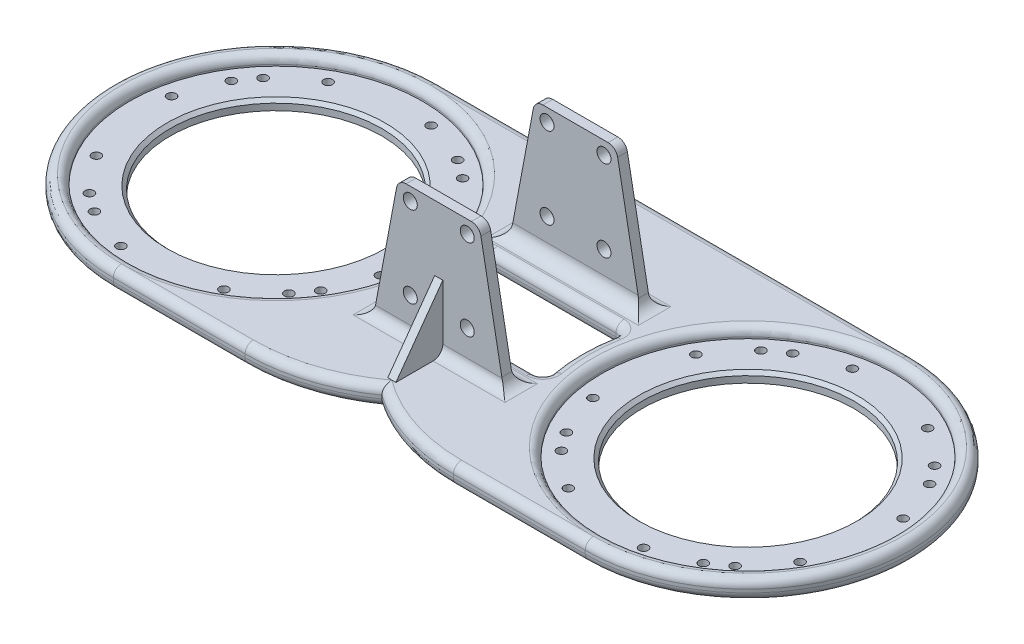
from build123d import *

# Parameters (mm, degrees)
EXTRUDE_1_DEPTH      = 6
EXTRUDE_1_DEPTH_BACK = 6
CUT_EXTRUDE_1_REACH  = 266.69
SKETCH_3_R           = 2.75
CUT_EXTRUDE_2_REACH  = 266.894
FILLET_1_R           = 5
FILLET_2_R           = 5
CHAMFER_1_SIZE       = 2
EXTRUDE_2_DEPTH      = 45
SKETCH_6_W           = 78
SKETCH_6_H           = 80
CUT_EXTRUDE_3_DEPTH  = 75
RIB_2_REACH          = 280.246
SKETCH_7_WALL_W      = 605.662493284
SKETCH_7_WALL_H      = 5
RIB_3_REACH          = 280.246
SKETCH_8_WALL_W      = 607.810143504
SKETCH_8_WALL_H      = 5
CUT_EXTRUDE_4_REACH  = 299.399
SKETCH_9_R           = 4.3
FILLET_4_R           = 8
FILLET_5_R           = 6
FILLET_6_R           = 6
CUT_EXTRUDE_5_REACH  = 278.451
FILLET_7_R           = 5


with BuildPart() as part:
    # 草图1 → 凸台-拉伸1 (new, two sides: drawn at the far end of the back side and taken through both)
    with BuildSketch(Plane(origin=(0, 0, 0), x_dir=(1, 0, 0), z_dir=(0, 1, 0)).offset(-EXTRUDE_1_DEPTH_BACK)):
        with BuildLine():
            Line((-145, 100), (145, 100))
            ThreePointArc((145, 100), (245, 0), (145, -100))
            Line((145, -100), (-145, -100))
            ThreePointArc((-145, -100), (-245, 0), (-145, 100))
        make_face()
    extrude(amount=EXTRUDE_1_DEPTH + EXTRUDE_1_DEPTH_BACK)

    # 草图2 → 切除-旋转1 (revolve, cut)
    with BuildSketch(Plane.XY, mode=Mode.PRIVATE) as cut_revolve_1_sk:
        Polygon((-145, -6), (-80, -6), (-80, 0), (-55, 0), (-55, 6), (-145, 6), align=None)
    cut_revolve_1 = revolve(cut_revolve_1_sk.sketch.rotate(Axis((-145, 6, 0), (0, -1, 0)), 90), axis=Axis((-145, 6, 0), (0, -1, 0)), mode=Mode.SUBTRACT)

    # 草图3 → 切除-拉伸1 (cut, up to next)
    with BuildSketch(Plane(origin=(0, 0, 0), x_dir=(1, 0, 0), z_dir=(0, 1, 0)), mode=Mode.PRIVATE) as cut_extrude_1_sk1:
        with Locations(Location((-102.948449102, 69.52143243, 0), (0, 0, 270))):
            Circle(SKETCH_3_R)
    cut_extrude_1_tool1 = extrude(cut_extrude_1_sk1.sketch, amount=-CUT_EXTRUDE_1_REACH, mode=Mode.PRIVATE) & part.part
    # 草图3 → 切除-拉伸1 (cut, up to next)
    with BuildSketch(Plane(origin=(0, 0, 0), x_dir=(1, 0, 0), z_dir=(0, 1, 0)), mode=Mode.PRIVATE) as cut_extrude_1_sk2:
        with Locations(Location((-91.648002637, 61.27909005, 0), (0, 0, 270))):
            Circle(SKETCH_3_R)
    cut_extrude_1_tool2 = extrude(cut_extrude_1_sk2.sketch, amount=-CUT_EXTRUDE_1_REACH, mode=Mode.PRIVATE) & part.part
    # 草图3 → 切除-拉伸1 (cut, up to next)
    with BuildSketch(Plane(origin=(0, 0, 0), x_dir=(1, 0, 0), z_dir=(0, 1, 0)), mode=Mode.PRIVATE) as cut_extrude_1_sk3:
        with Locations(Location((-73.821572439, 39.181551143, 0), (0, 0, 270))):
            Circle(SKETCH_3_R)
    cut_extrude_1_tool3 = extrude(cut_extrude_1_sk3.sketch, amount=-CUT_EXTRUDE_1_REACH, mode=Mode.PRIVATE) & part.part
    # 草图3 → 切除-拉伸1 (cut, up to next)
    with BuildSketch(Plane(origin=(0, 0, 0), x_dir=(1, 0, 0), z_dir=(0, 1, 0)), mode=Mode.PRIVATE) as cut_extrude_1_sk4:
        with Locations(Location((-129.435359966, 79.745247386, 0), (0, 0, 270))):
            Circle(SKETCH_3_R)
    cut_extrude_1_tool4 = extrude(cut_extrude_1_sk4.sketch, amount=-CUT_EXTRUDE_1_REACH, mode=Mode.PRIVATE) & part.part
    # 草图3 → 切除-拉伸1 (cut, up to next)
    with BuildSketch(Plane(origin=(0, 0, 0), x_dir=(1, 0, 0), z_dir=(0, 1, 0)), mode=Mode.PRIVATE) as cut_extrude_1_sk5:
        with Locations(Location((-75.47856757, -42.051550898, 0), (0, 0, 270))):
            Circle(SKETCH_3_R)
    cut_extrude_1_tool5 = extrude(cut_extrude_1_sk5.sketch, amount=-CUT_EXTRUDE_1_REACH, mode=Mode.PRIVATE) & part.part
    # 草图3 → 切除-拉伸1 (cut, up to next)
    with BuildSketch(Plane(origin=(0, 0, 0), x_dir=(1, 0, 0), z_dir=(0, 1, 0)), mode=Mode.PRIVATE) as cut_extrude_1_sk6:
        with Locations(Location((-83.72090995, -53.351997363, 0), (0, 0, 270))):
            Circle(SKETCH_3_R)
    cut_extrude_1_tool6 = extrude(cut_extrude_1_sk6.sketch, amount=-CUT_EXTRUDE_1_REACH, mode=Mode.PRIVATE) & part.part
    # 草图3 → 切除-拉伸1 (cut, up to next)
    with BuildSketch(Plane(origin=(0, 0, 0), x_dir=(1, 0, 0), z_dir=(0, 1, 0)), mode=Mode.PRIVATE) as cut_extrude_1_sk7:
        with Locations(Location((-105.818448857, -71.178427561, 0), (0, 0, 270))):
            Circle(SKETCH_3_R)
    cut_extrude_1_tool7 = extrude(cut_extrude_1_sk7.sketch, amount=-CUT_EXTRUDE_1_REACH, mode=Mode.PRIVATE) & part.part
    # 草图3 → 切除-拉伸1 (cut, up to next)
    with BuildSketch(Plane(origin=(0, 0, 0), x_dir=(1, 0, 0), z_dir=(0, 1, 0)), mode=Mode.PRIVATE) as cut_extrude_1_sk8:
        with Locations(Location((-65.254752614, -15.564640034, 0), (0, 0, 270))):
            Circle(SKETCH_3_R)
    cut_extrude_1_tool8 = extrude(cut_extrude_1_sk8.sketch, amount=-CUT_EXTRUDE_1_REACH, mode=Mode.PRIVATE) & part.part
    # 草图3 → 切除-拉伸1 (cut, up to next)
    with BuildSketch(Plane(origin=(0, 0, 0), x_dir=(1, 0, 0), z_dir=(0, 1, 0)), mode=Mode.PRIVATE) as cut_extrude_1_sk9:
        with Locations(Location((-187.051550898, -69.52143243, 0), (0, 0, 270))):
            Circle(SKETCH_3_R)
    cut_extrude_1_tool9 = extrude(cut_extrude_1_sk9.sketch, amount=-CUT_EXTRUDE_1_REACH, mode=Mode.PRIVATE) & part.part
    # 草图3 → 切除-拉伸1 (cut, up to next)
    with BuildSketch(Plane(origin=(0, 0, 0), x_dir=(1, 0, 0), z_dir=(0, 1, 0)), mode=Mode.PRIVATE) as cut_extrude_1_sk10:
        with Locations(Location((-198.351997363, -61.27909005, 0), (0, 0, 270))):
            Circle(SKETCH_3_R)
    cut_extrude_1_tool10 = extrude(cut_extrude_1_sk10.sketch, amount=-CUT_EXTRUDE_1_REACH, mode=Mode.PRIVATE) & part.part
    # 草图3 → 切除-拉伸1 (cut, up to next)
    with BuildSketch(Plane(origin=(0, 0, 0), x_dir=(1, 0, 0), z_dir=(0, 1, 0)), mode=Mode.PRIVATE) as cut_extrude_1_sk11:
        with Locations(Location((-216.178427561, -39.181551143, 0), (0, 0, 270))):
            Circle(SKETCH_3_R)
    cut_extrude_1_tool11 = extrude(cut_extrude_1_sk11.sketch, amount=-CUT_EXTRUDE_1_REACH, mode=Mode.PRIVATE) & part.part
    # 草图3 → 切除-拉伸1 (cut, up to next)
    with BuildSketch(Plane(origin=(0, 0, 0), x_dir=(1, 0, 0), z_dir=(0, 1, 0)), mode=Mode.PRIVATE) as cut_extrude_1_sk12:
        with Locations(Location((-160.564640034, -79.745247386, 0), (0, 0, 270))):
            Circle(SKETCH_3_R)
    cut_extrude_1_tool12 = extrude(cut_extrude_1_sk12.sketch, amount=-CUT_EXTRUDE_1_REACH, mode=Mode.PRIVATE) & part.part
    # 草图3 → 切除-拉伸1 (cut, up to next)
    with BuildSketch(Plane(origin=(0, 0, 0), x_dir=(1, 0, 0), z_dir=(0, 1, 0)), mode=Mode.PRIVATE) as cut_extrude_1_sk13:
        with Locations(Location((-214.52143243, 42.051550898, 0), (0, 0, 270))):
            Circle(SKETCH_3_R)
    cut_extrude_1_tool13 = extrude(cut_extrude_1_sk13.sketch, amount=-CUT_EXTRUDE_1_REACH, mode=Mode.PRIVATE) & part.part
    # 草图3 → 切除-拉伸1 (cut, up to next)
    with BuildSketch(Plane(origin=(0, 0, 0), x_dir=(1, 0, 0), z_dir=(0, 1, 0)), mode=Mode.PRIVATE) as cut_extrude_1_sk14:
        with Locations(Location((-206.27909005, 53.351997363, 0), (0, 0, 270))):
            Circle(SKETCH_3_R)
    cut_extrude_1_tool14 = extrude(cut_extrude_1_sk14.sketch, amount=-CUT_EXTRUDE_1_REACH, mode=Mode.PRIVATE) & part.part
    # 草图3 → 切除-拉伸1 (cut, up to next)
    with BuildSketch(Plane(origin=(0, 0, 0), x_dir=(1, 0, 0), z_dir=(0, 1, 0)), mode=Mode.PRIVATE) as cut_extrude_1_sk15:
        with Locations(Location((-184.181551143, 71.178427561, 0), (0, 0, 270))):
            Circle(SKETCH_3_R)
    cut_extrude_1_tool15 = extrude(cut_extrude_1_sk15.sketch, amount=-CUT_EXTRUDE_1_REACH, mode=Mode.PRIVATE) & part.part
    # 草图3 → 切除-拉伸1 (cut, up to next)
    with BuildSketch(Plane(origin=(0, 0, 0), x_dir=(1, 0, 0), z_dir=(0, 1, 0)), mode=Mode.PRIVATE) as cut_extrude_1_sk16:
        with Locations(Location((-224.745247386, 15.564640034, 0), (0, 0, 270))):
            Circle(SKETCH_3_R)
    cut_extrude_1_tool16 = extrude(cut_extrude_1_sk16.sketch, amount=-CUT_EXTRUDE_1_REACH, mode=Mode.PRIVATE) & part.part
    cut_extrude_1_1 = cut_extrude_1_tool1.solids().sort_by_distance((-102.948449, 0, -69.521432))[0]
    add(cut_extrude_1_1, mode=Mode.SUBTRACT)
    cut_extrude_1_2 = cut_extrude_1_tool2.solids().sort_by_distance((-91.648003, 0, -61.27909))[0]
    add(cut_extrude_1_2, mode=Mode.SUBTRACT)
    cut_extrude_1_3 = cut_extrude_1_tool3.solids().sort_by_distance((-73.821572, 0, -39.181551))[0]
    add(cut_extrude_1_3, mode=Mode.SUBTRACT)
    cut_extrude_1_4 = cut_extrude_1_tool4.solids().sort_by_distance((-129.43536, 0, -79.745247))[0]
    add(cut_extrude_1_4, mode=Mode.SUBTRACT)
    cut_extrude_1_5 = cut_extrude_1_tool5.solids().sort_by_distance((-75.478568, 0, 42.051551))[0]
    add(cut_extrude_1_5, mode=Mode.SUBTRACT)
    cut_extrude_1_6 = cut_extrude_1_tool6.solids().sort_by_distance((-83.72091, 0, 53.351997))[0]
    add(cut_extrude_1_6, mode=Mode.SUBTRACT)
    cut_extrude_1_7 = cut_extrude_1_tool7.solids().sort_by_distance((-105.818449, 0, 71.178428))[0]
    add(cut_extrude_1_7, mode=Mode.SUBTRACT)
    cut_extrude_1_8 = cut_extrude_1_tool8.solids().sort_by_distance((-65.254753, 0, 15.56464))[0]
    add(cut_extrude_1_8, mode=Mode.SUBTRACT)
    cut_extrude_1_9 = cut_extrude_1_tool9.solids().sort_by_distance((-187.051551, 0, 69.521432))[0]
    add(cut_extrude_1_9, mode=Mode.SUBTRACT)
    cut_extrude_1_10 = cut_extrude_1_tool10.solids().sort_by_distance((-198.351997, 0, 61.27909))[0]
    add(cut_extrude_1_10, mode=Mode.SUBTRACT)
    cut_extrude_1_11 = cut_extrude_1_tool11.solids().sort_by_distance((-216.178428, 0, 39.181551))[0]
    add(cut_extrude_1_11, mode=Mode.SUBTRACT)
    cut_extrude_1_12 = cut_extrude_1_tool12.solids().sort_by_distance((-160.56464, 0, 79.745247))[0]
    add(cut_extrude_1_12, mode=Mode.SUBTRACT)
    cut_extrude_1_13 = cut_extrude_1_tool13.solids().sort_by_distance((-214.521432, 0, -42.051551))[0]
    add(cut_extrude_1_13, mode=Mode.SUBTRACT)
    cut_extrude_1_14 = cut_extrude_1_tool14.solids().sort_by_distance((-206.27909, 0, -53.351997))[0]
    add(cut_extrude_1_14, mode=Mode.SUBTRACT)
    cut_extrude_1_15 = cut_extrude_1_tool15.solids().sort_by_distance((-184.181551, 0, -71.178428))[0]
    add(cut_extrude_1_15, mode=Mode.SUBTRACT)
    cut_extrude_1_16 = cut_extrude_1_tool16.solids().sort_by_distance((-224.745247, 0, -15.56464))[0]
    add(cut_extrude_1_16, mode=Mode.SUBTRACT)
    cut_extrude_1 = cut_extrude_1_1 + cut_extrude_1_2 + cut_extrude_1_3 + cut_extrude_1_4 + cut_extrude_1_5 + cut_extrude_1_6 + cut_extrude_1_7 + cut_extrude_1_8 + cut_extrude_1_9 + cut_extrude_1_10 + cut_extrude_1_11 + cut_extrude_1_12 + cut_extrude_1_13 + cut_extrude_1_14 + cut_extrude_1_15 + cut_extrude_1_16  # 切除-拉伸1 as one shape, for the pattern or mirror that repeats it

    # 镜向1: 切除-旋转1, 切除-拉伸1 across plane
    add(cut_revolve_1.mirror(Plane(origin=(0, 0, 0), x_dir=(0, 0, 1), z_dir=(1, 0, 0))), mode=Mode.SUBTRACT)
    add(cut_extrude_1.mirror(Plane(origin=(0, 0, 0), x_dir=(0, 0, 1), z_dir=(1, 0, 0))), mode=Mode.SUBTRACT)

    # 草图4 → 切除-拉伸2 (cut, up to next)
    with BuildSketch(Plane(origin=(0, 6, 0), x_dir=(1, 0, 0), z_dir=(0, 1, 0)), mode=Mode.PRIVATE) as cut_extrude_2_sk1:
        with BuildLine():
            Line((-64, -100), (64, -100))
            ThreePointArc((64, -100), (30.473890772, -94.883549531), (0, -80))
            ThreePointArc((0, -80), (-30.473890772, -94.883549531), (-64, -100))
        make_face()
    cut_extrude_2_tool1 = extrude(cut_extrude_2_sk1.sketch, amount=-CUT_EXTRUDE_2_REACH, mode=Mode.PRIVATE) & part.part
    add(cut_extrude_2_tool1.solids().sort_by_distance((0, 6, 94.104085))[0], mode=Mode.SUBTRACT)

    # 圆角1
    fillet_1_edges = [part.edges().sort_by_distance(p)[0] for p in [
        (245, -6, 0),
        (104.5, -6, 100),
        (-30.473890772, -6, 94.883549531),
        (30.473890772, -6, 94.883549531),
        (0, -6, -100),
        (-245, -6, 0),
        (-104.5, -6, 100),
    ]]
    fillet(fillet_1_edges, radius=FILLET_1_R)

    # 圆角2
    fillet_2_edges = [part.edges().sort_by_distance(p)[0] for p in [
        (-245, 6, 0),
        (-104.5, 6, 100),
        (245, 6, 0),
        (0, 6, -100),
        (104.5, 6, 100),
        (-30.473890772, 6, 94.883549531),
        (30.473890772, 6, 94.883549531),
        (-145, 6, -90),
        (145, 6, -90),
    ]]
    fillet(fillet_2_edges, radius=FILLET_2_R - 0.0001)  # a hair under: the kernel refuses the full size

    # 倒角1
    chamfer_1_edges = [part.edges().sort_by_distance(p)[0] for p in [
        (-145, 0, -65),
        (145, 0, -65),
    ]]
    chamfer(chamfer_1_edges, length=CHAMFER_1_SIZE)

    # 草图5 → 凸台-拉伸2 (add, symmetric)
    with BuildSketch(Plane.XY):
        Polygon((-40, 6), (40, 6), (25, 86), (-25, 86), align=None)
    extrude(amount=EXTRUDE_2_DEPTH, both=True)

    # 草图6 → 切除-拉伸3 (cut, symmetric)
    with BuildSketch(Plane(origin=(0, 0, 0), x_dir=(0, 0, -1), z_dir=(1, 0, 0))):
        with Locations((0, 46)):
            Rectangle(SKETCH_6_W, SKETCH_6_H)
    extrude(amount=CUT_EXTRUDE_3_DEPTH, both=True, mode=Mode.SUBTRACT)

    # 草图7 wall → 筋2 (add, up to next)
    with BuildSketch(Plane(origin=(0, 26, -57.5), x_dir=(0, 0.847998304005, 0.529998940003), z_dir=(0, -0.529998940003, 0.847998304005)), mode=Mode.PRIVATE) as rib_2_sk1:
        Rectangle(SKETCH_7_WALL_W, SKETCH_7_WALL_H)
    rib_2_tool1 = extrude(rib_2_sk1.sketch, amount=RIB_2_REACH, mode=Mode.PRIVATE) - part.part
    add(rib_2_tool1.solids().sort_by_distance((0, 26, -57.5))[0])

    # 草图8 wall → 筋3 (add, up to next)
    with BuildSketch(Plane(origin=(0, 26, 59.42412318), x_dir=(0, 0.8110702018, -0.5849488249), z_dir=(0, 0.5849488249, 0.8110702018)), mode=Mode.PRIVATE) as rib_3_sk1:
        Rectangle(SKETCH_8_WALL_W, SKETCH_8_WALL_H)
    rib_3_tool1 = extrude(rib_3_sk1.sketch, amount=-RIB_3_REACH, mode=Mode.PRIVATE) - part.part
    add(rib_3_tool1.solids().sort_by_distance((0, 26, 59.42412318))[0])

    # 草图9 → 切除-拉伸4 (cut, up to next)
    with BuildSketch(Plane.XY.offset(45), mode=Mode.PRIVATE) as cut_extrude_4_sk1:
        with Locations((-17.5, 78)):
            Circle(SKETCH_9_R)
    cut_extrude_4_tool1 = extrude(cut_extrude_4_sk1.sketch, amount=-CUT_EXTRUDE_4_REACH, mode=Mode.PRIVATE) & part.part
    # 草图9 → 切除-拉伸4 (cut, up to next)
    with BuildSketch(Plane.XY.offset(45), mode=Mode.PRIVATE) as cut_extrude_4_sk2:
        with Locations((17.5, 78)):
            Circle(SKETCH_9_R)
    cut_extrude_4_tool2 = extrude(cut_extrude_4_sk2.sketch, amount=-CUT_EXTRUDE_4_REACH, mode=Mode.PRIVATE) & part.part
    # 草图9 → 切除-拉伸4 (cut, up to next)
    with BuildSketch(Plane.XY.offset(45), mode=Mode.PRIVATE) as cut_extrude_4_sk3:
        with Locations((17.5, 28)):
            Circle(SKETCH_9_R)
    cut_extrude_4_tool3 = extrude(cut_extrude_4_sk3.sketch, amount=-CUT_EXTRUDE_4_REACH, mode=Mode.PRIVATE) & part.part
    # 草图9 → 切除-拉伸4 (cut, up to next)
    with BuildSketch(Plane.XY.offset(45), mode=Mode.PRIVATE) as cut_extrude_4_sk4:
        with Locations((-17.5, 28)):
            Circle(SKETCH_9_R)
    cut_extrude_4_tool4 = extrude(cut_extrude_4_sk4.sketch, amount=-CUT_EXTRUDE_4_REACH, mode=Mode.PRIVATE) & part.part
    add(cut_extrude_4_tool1.solids().sort_by_distance((-17.5, 78, 45))[0], mode=Mode.SUBTRACT)
    add(cut_extrude_4_tool1.solids().sort_by_distance((-17.5, 78, 45))[1], mode=Mode.SUBTRACT)
    add(cut_extrude_4_tool2.solids().sort_by_distance((17.5, 78, 45))[0], mode=Mode.SUBTRACT)
    add(cut_extrude_4_tool2.solids().sort_by_distance((17.5, 78, 45))[1], mode=Mode.SUBTRACT)
    add(cut_extrude_4_tool3.solids().sort_by_distance((17.5, 28, 45))[0], mode=Mode.SUBTRACT)
    add(cut_extrude_4_tool3.solids().sort_by_distance((17.5, 28, 45))[1], mode=Mode.SUBTRACT)
    add(cut_extrude_4_tool4.solids().sort_by_distance((-17.5, 28, 45))[0], mode=Mode.SUBTRACT)
    add(cut_extrude_4_tool4.solids().sort_by_distance((-17.5, 28, 45))[1], mode=Mode.SUBTRACT)

    # 圆角4
    fillet_4_edges = [part.edges().sort_by_distance(p)[0] for p in [
        (40, 6, 42),
        (-40, 6, 42),
        (-40, 6, -42),
        (40, 6, -42),
        (0, 6, -39),
        (0, 6, 39),
    ]]
    fillet(fillet_4_edges, radius=FILLET_4_R)

    # 圆角5
    fillet_5_edges = [part.edges().sort_by_distance(p)[0] for p in [
        (-24.569705149, 6, -45),
        (-24.569705149, 6, 45),
        (24.569705149, 6, -45),
        (24.569705149, 6, 45),
    ]]
    fillet(fillet_5_edges, radius=FILLET_5_R)

    # 圆角6
    fillet_6_edges = [part.edges().sort_by_distance(p)[0] for p in [
        (25, 86, 42),
        (-25, 86, 42),
        (-25, 86, -42),
        (25, 86, -42),
    ]]
    fillet(fillet_6_edges, radius=FILLET_6_R)

    # 草图10 → 切除-拉伸5 (cut, up to next)
    with BuildSketch(Plane(origin=(0, 6, 0), x_dir=(1, 0, 0), z_dir=(0, 1, 0)), mode=Mode.PRIVATE) as cut_extrude_5_sk1:
        with BuildLine():
            Line((-45.080032026, 25), (45.080032026, 25))
            ThreePointArc((45.080032026, 25), (42, 0), (45.080032026, -25))
            Line((45.080032026, -25), (-45.080032026, -25))
            ThreePointArc((-45.080032026, -25), (-42, 0), (-45.080032026, 25))
        make_face()
    cut_extrude_5_tool1 = extrude(cut_extrude_5_sk1.sketch, amount=-CUT_EXTRUDE_5_REACH, mode=Mode.PRIVATE) & part.part
    add(cut_extrude_5_tool1.solids().sort_by_distance((0, 6, 0))[0], mode=Mode.SUBTRACT)

    # 圆角7
    fillet_7_edges = [part.edges().sort_by_distance(p)[0] for p in [
        (-45.080032026, 0, 25),
        (-45.080032026, 0, -25),
        (45.080032026, 0, -25),
        (45.080032026, 0, 25),
        (-42, 6, 0),
        (0, 6, 25),
        (42, 6, 0),
        (0, 6, -25),
        (0, -6, 25),
        (-42, -6, 0),
        (0, -6, -25),
        (42, -6, 0),
    ]]
    fillet(fillet_7_edges, radius=FILLET_7_R)


solid = part.part
